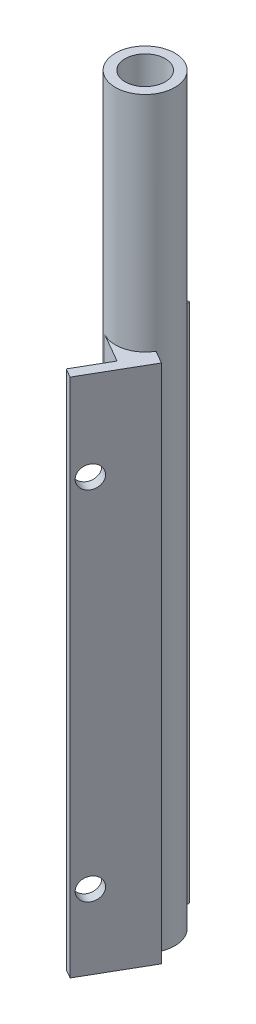
from build123d import *

# Parameters (mm, degrees)
SKETCH1_R           = 5.08
BOSS_EXTRUDE1_DEPTH = 127
SKETCH2_R           = 3.429
CUT_EXTRUDE1_DEPTH  = 128.2030377
BOSS_EXTRUDE2_DEPTH = 88.9
HOLE_CUTS_1_REACH   = 130.39
SKETCH4_R           = 1.905
HOLE_CUTS_2_REACH   = 130.39
SKETCH7_R           = 1.905
CUT_EXTRUDE7_REACH  = 130.39
SKETCH8_W           = 6.35
SKETCH8_H           = 4.572
SKETCH9_W           = 11.43
SKETCH9_H           = 88.9
CUT_EXTRUDE8_DEPTH  = 2.54
SKETCH10_W          = 11.43
SKETCH10_H          = 88.9
CUT_EXTRUDE9_DEPTH  = 2.54
SKETCH11_W          = 6.35
SKETCH11_H          = 88.9
CUT_EXTRUDE10_DEPTH = 1.27
SKETCH13_W          = 6.35
SKETCH13_H          = 88.9
CUT_EXTRUDE11_DEPTH = 1.27


with BuildPart() as part:
    # Sketch1 → Boss-Extrude1 (new body)
    with BuildSketch(Plane(origin=(0, 0, 0), x_dir=(1, 0, 0), z_dir=(0, 1, 0))):
        Circle(SKETCH1_R)
    extrude(amount=BOSS_EXTRUDE1_DEPTH)

    # Sketch2 → Cut-Extrude1 (cut, through all)
    with BuildSketch(Plane.XZ):
        Circle(SKETCH2_R)
    extrude(amount=-CUT_EXTRUDE1_DEPTH, mode=Mode.SUBTRACT)

    # Sketch3 → Boss-Extrude2 (add)
    with BuildSketch(Plane.XZ):
        with BuildLine():
            Line((-1.315590949, 12.438670365), (-5.715, 9.898670365))
            Line((-5.715, 9.898670365), (-2.54, 4.399409051))
            ThreePointArc((-2.54, 4.399409051), (2.96960111, -1.7145), (-5.08, 0))
            Line((-5.08, 0), (-11.43, 0))
            Line((-11.43, 0), (-11.43, -5.08))
            Line((-11.43, -5.08), (-11.43, -10.16))
            Line((-11.43, -10.16), (0, -10.16))
            Line((0, -10.16), (0, -5.08))
            ThreePointArc((0, -5.08), (4.399409051, -2.54), (4.399409051, 2.54))
            Line((4.399409051, 2.54), (8.798818102, 5.08))
            Line((8.798818102, 5.08), (3.083818102, 14.978670365))
            Line((3.083818102, 14.978670365), (-1.315590949, 12.438670365))
        make_face()
    extrude(amount=-BOSS_EXTRUDE2_DEPTH)

    # Sketch4 → Hole Cuts 1 (cut, up to next)
    with BuildSketch(Plane.XY, mode=Mode.PRIVATE) as hole_cuts_1_sk1:
        with Locations((-8.89, 81.28)):
            Circle(SKETCH4_R)
    hole_cuts_1_tool1 = extrude(hole_cuts_1_sk1.sketch, amount=-HOLE_CUTS_1_REACH, mode=Mode.PRIVATE) & part.part
    # Sketch4 → Hole Cuts 1 (cut, up to next)
    with BuildSketch(Plane.XY, mode=Mode.PRIVATE) as hole_cuts_1_sk2:
        with Locations((-8.89, 20.32)):
            Circle(SKETCH4_R)
    hole_cuts_1_tool2 = extrude(hole_cuts_1_sk2.sketch, amount=-HOLE_CUTS_1_REACH, mode=Mode.PRIVATE) & part.part
    add(hole_cuts_1_tool1.solids().sort_by_distance((-8.89, 81.28, 0))[0], mode=Mode.SUBTRACT)
    add(hole_cuts_1_tool2.solids().sort_by_distance((-8.89, 20.32, 0))[0], mode=Mode.SUBTRACT)

    # Sketch7 → Hole Cuts 2 (cut, up to next)
    with BuildSketch(Plane(origin=(0, 0, 0), x_dir=(0.49999999999999784, 0, -0.86602540378444), z_dir=(0.86602540378444, 0, 0.49999999999999784)), mode=Mode.PRIVATE) as hole_cuts_2_sk1:
        with Locations((-8.89, 73.66)):
            Circle(SKETCH7_R)
    hole_cuts_2_tool1 = extrude(hole_cuts_2_sk1.sketch, amount=HOLE_CUTS_2_REACH, mode=Mode.PRIVATE) & part.part
    # Sketch7 → Hole Cuts 2 (cut, up to next)
    with BuildSketch(Plane(origin=(0, 0, 0), x_dir=(0.49999999999999784, 0, -0.86602540378444), z_dir=(0.86602540378444, 0, 0.49999999999999784)), mode=Mode.PRIVATE) as hole_cuts_2_sk2:
        with Locations((-8.89, 12.7)):
            Circle(SKETCH7_R)
    hole_cuts_2_tool2 = extrude(hole_cuts_2_sk2.sketch, amount=HOLE_CUTS_2_REACH, mode=Mode.PRIVATE) & part.part
    add(hole_cuts_2_tool1.solids().sort_by_distance((-4.445, 73.66, 7.698966))[0], mode=Mode.SUBTRACT)
    add(hole_cuts_2_tool2.solids().sort_by_distance((-4.445, 12.7, 7.698966))[0], mode=Mode.SUBTRACT)

    # Sketch8 → Cut-Extrude7 (cut, up to next)
    with BuildSketch(Plane.XZ, mode=Mode.PRIVATE) as cut_extrude7_sk1:
        Polygon((-5.715, 9.898670365), (-1.755531854, 12.184670365), (1.419468146, 6.685409051), (-2.54, 4.399409051), align=None)
    cut_extrude7_tool1 = extrude(cut_extrude7_sk1.sketch, amount=-CUT_EXTRUDE7_REACH, mode=Mode.PRIVATE) & part.part
    # Sketch8 → Cut-Extrude7 (cut, up to next)
    with BuildSketch(Plane.XZ, mode=Mode.PRIVATE) as cut_extrude7_sk2:
        with Locations((-8.255, -2.286)):
            Rectangle(SKETCH8_W, SKETCH8_H)
    cut_extrude7_tool2 = extrude(cut_extrude7_sk2.sketch, amount=-CUT_EXTRUDE7_REACH, mode=Mode.PRIVATE) & part.part
    add(cut_extrude7_tool1.solids().sort_by_distance((-2.147766, 0, 8.29204))[0], mode=Mode.SUBTRACT)
    add(cut_extrude7_tool2.solids().sort_by_distance((-8.255, 0, -2.286))[0], mode=Mode.SUBTRACT)

    # Sketch9 → Cut-Extrude8 (cut)
    with BuildSketch(Plane(origin=(0, 0, -10.16), x_dir=(-1, 0, 0), z_dir=(0, 0, -1))):
        with Locations((5.715, 44.45)):
            Rectangle(SKETCH9_W, SKETCH9_H)
    extrude(amount=-CUT_EXTRUDE8_DEPTH, mode=Mode.SUBTRACT)

    # Sketch10 → Cut-Extrude9 (cut)
    with BuildSketch(Plane(origin=(8.798818102, 0, 5.08), x_dir=(0.4999999999999982, 0, -0.8660254037844397), z_dir=(0.8660254037844398, 0, 0.4999999999999983))):
        with Locations((-5.715, 44.45)):
            Rectangle(SKETCH10_W, SKETCH10_H)
    extrude(amount=-CUT_EXTRUDE9_DEPTH, mode=Mode.SUBTRACT)

    # Sketch11 → Cut-Extrude10 (cut)
    with BuildSketch(Plane.XY.offset(-4.572)):
        with Locations((-8.255, 44.45)):
            Rectangle(SKETCH11_W, SKETCH11_H)
    extrude(amount=-CUT_EXTRUDE10_DEPTH, mode=Mode.SUBTRACT)

    # Sketch13 → Cut-Extrude11 (cut)
    with BuildSketch(Plane(origin=(3.959468146, 0, 2.286), x_dir=(-0.5000000000000004, 0, 0.8660254037844384), z_dir=(-0.8660254037844384, 0, -0.5000000000000004))):
        with Locations((8.255, 44.45)):
            Rectangle(SKETCH13_W, SKETCH13_H)
    extrude(amount=-CUT_EXTRUDE11_DEPTH, mode=Mode.SUBTRACT)


solid = part.part
